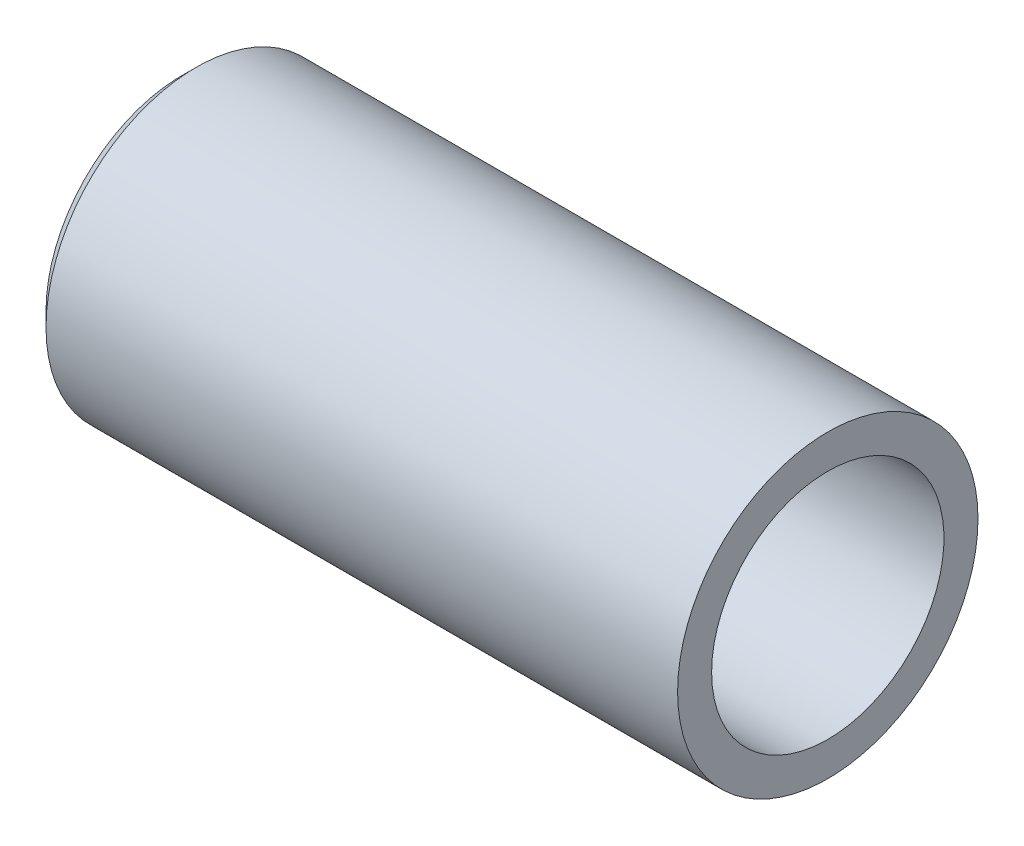
from build123d import *


with BuildPart() as part:
    # Sketch1 → Revolve1 (revolve)
    with BuildSketch(Plane.XY):
        Polygon((0.850181228, 5.295749886), (23.117875, 5.295749886), (23.117875, 4.09575), (0.353125, 4.09575), (0.353125, 4.798693658), align=None)
    revolve(axis=Axis((0, 0, 0), (1, 0, 0)))


solid = part.part
